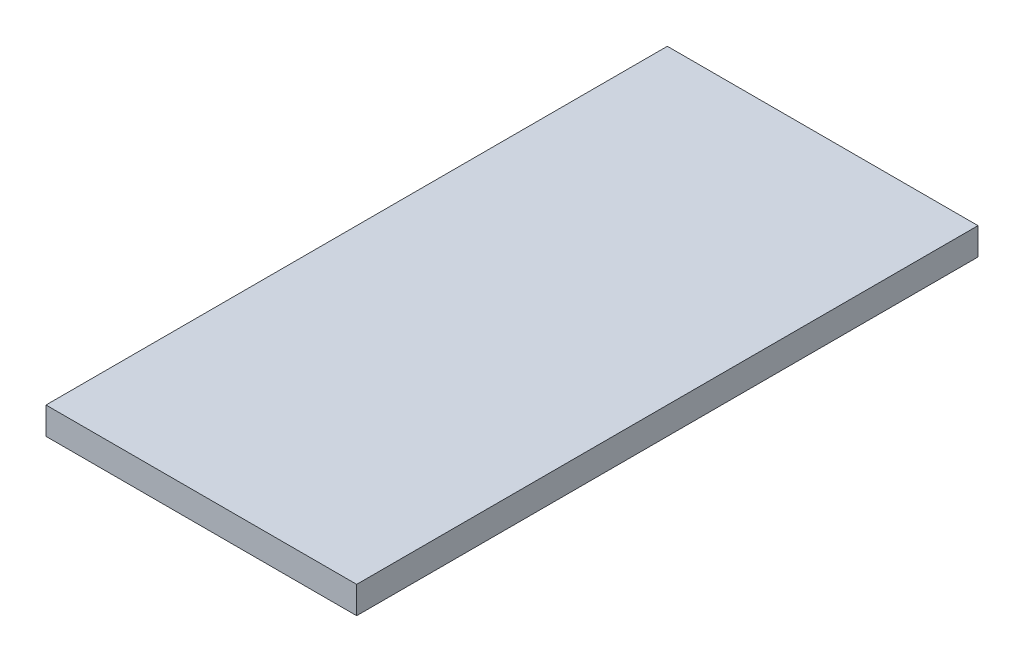
from build123d import *

# Parameters (mm, degrees)
SKETCH1_W           = 1016
SKETCH1_H           = 2032
BOSS_EXTRUDE1_DEPTH = 88.9


with BuildPart() as part:
    # Sketch1 → Boss-Extrude1 (new body)
    with BuildSketch(Plane(origin=(0, 0, 0), x_dir=(1, 0, 0), z_dir=(0, 1, 0))):
        Rectangle(SKETCH1_W, SKETCH1_H)
    extrude(amount=BOSS_EXTRUDE1_DEPTH)


solid = part.part
